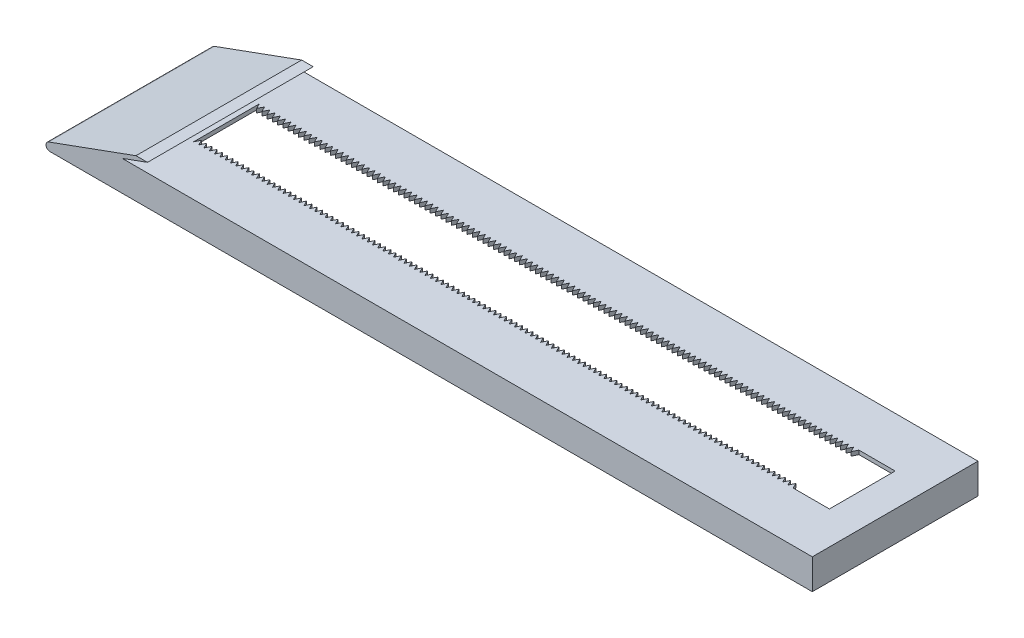
from build123d import *

# Parameters (mm, degrees)
BOSS_EXTRUDE1_DEPTH    = 120
BOSS_EXTRUDE2_DEPTH    = 3
BOSS_EXTRUDE3_DEPTH    = 3
SKETCH4_W              = 126
SKETCH4_H              = 23
BOSS_EXTRUDE4_DEPTH    = 3
SKETCH5_W              = 483.528980942
SKETCH5_H              = 50
CUT_EXTRUDE1_DEPTH     = 3
BOSS_EXTRUDE5_DEPTH    = 3
LPATTERN1_COUNT        = 114
LPATTERN1_PITCH        = 4
MIRROR1_COPY_1_DEPTH   = 3
MIRROR1_COPY_2_DEPTH   = 3
MIRROR1_COPY_3_DEPTH   = 3
MIRROR1_COPY_4_DEPTH   = 3
MIRROR1_COPY_5_DEPTH   = 3
MIRROR1_COPY_6_DEPTH   = 3
MIRROR1_COPY_7_DEPTH   = 3
MIRROR1_COPY_8_DEPTH   = 3
MIRROR1_COPY_9_DEPTH   = 3
MIRROR1_COPY_10_DEPTH  = 3
MIRROR1_COPY_11_DEPTH  = 3
MIRROR1_COPY_12_DEPTH  = 3
MIRROR1_COPY_13_DEPTH  = 3
MIRROR1_COPY_14_DEPTH  = 3
MIRROR1_COPY_15_DEPTH  = 3
MIRROR1_COPY_16_DEPTH  = 3
MIRROR1_COPY_17_DEPTH  = 3
MIRROR1_COPY_18_DEPTH  = 3
MIRROR1_COPY_19_DEPTH  = 3
MIRROR1_COPY_20_DEPTH  = 3
MIRROR1_COPY_21_DEPTH  = 3
MIRROR1_COPY_22_DEPTH  = 3
MIRROR1_COPY_23_DEPTH  = 3
MIRROR1_COPY_24_DEPTH  = 3
MIRROR1_COPY_25_DEPTH  = 3
MIRROR1_COPY_26_DEPTH  = 3
MIRROR1_COPY_27_DEPTH  = 3
MIRROR1_COPY_28_DEPTH  = 3
MIRROR1_COPY_29_DEPTH  = 3
MIRROR1_COPY_30_DEPTH  = 3
MIRROR1_COPY_31_DEPTH  = 3
MIRROR1_COPY_32_DEPTH  = 3
MIRROR1_COPY_33_DEPTH  = 3
MIRROR1_COPY_34_DEPTH  = 3
MIRROR1_COPY_35_DEPTH  = 3
MIRROR1_COPY_36_DEPTH  = 3
MIRROR1_COPY_37_DEPTH  = 3
MIRROR1_COPY_38_DEPTH  = 3
MIRROR1_COPY_39_DEPTH  = 3
MIRROR1_COPY_40_DEPTH  = 3
MIRROR1_COPY_41_DEPTH  = 3
MIRROR1_COPY_42_DEPTH  = 3
MIRROR1_COPY_43_DEPTH  = 3
MIRROR1_COPY_44_DEPTH  = 3
MIRROR1_COPY_45_DEPTH  = 3
MIRROR1_COPY_46_DEPTH  = 3
MIRROR1_COPY_47_DEPTH  = 3
MIRROR1_COPY_48_DEPTH  = 3
MIRROR1_COPY_49_DEPTH  = 3
MIRROR1_COPY_50_DEPTH  = 3
MIRROR1_COPY_51_DEPTH  = 3
MIRROR1_COPY_52_DEPTH  = 3
MIRROR1_COPY_53_DEPTH  = 3
MIRROR1_COPY_54_DEPTH  = 3
MIRROR1_COPY_55_DEPTH  = 3
MIRROR1_COPY_56_DEPTH  = 3
MIRROR1_COPY_57_DEPTH  = 3
MIRROR1_COPY_58_DEPTH  = 3
MIRROR1_COPY_59_DEPTH  = 3
MIRROR1_COPY_60_DEPTH  = 3
MIRROR1_COPY_61_DEPTH  = 3
MIRROR1_COPY_62_DEPTH  = 3
MIRROR1_COPY_63_DEPTH  = 3
MIRROR1_COPY_64_DEPTH  = 3
MIRROR1_COPY_65_DEPTH  = 3
MIRROR1_COPY_66_DEPTH  = 3
MIRROR1_COPY_67_DEPTH  = 3
MIRROR1_COPY_68_DEPTH  = 3
MIRROR1_COPY_69_DEPTH  = 3
MIRROR1_COPY_70_DEPTH  = 3
MIRROR1_COPY_71_DEPTH  = 3
MIRROR1_COPY_72_DEPTH  = 3
MIRROR1_COPY_73_DEPTH  = 3
MIRROR1_COPY_74_DEPTH  = 3
MIRROR1_COPY_75_DEPTH  = 3
MIRROR1_COPY_76_DEPTH  = 3
MIRROR1_COPY_77_DEPTH  = 3
MIRROR1_COPY_78_DEPTH  = 3
MIRROR1_COPY_79_DEPTH  = 3
MIRROR1_COPY_80_DEPTH  = 3
MIRROR1_COPY_81_DEPTH  = 3
MIRROR1_COPY_82_DEPTH  = 3
MIRROR1_COPY_83_DEPTH  = 3
MIRROR1_COPY_84_DEPTH  = 3
MIRROR1_COPY_85_DEPTH  = 3
MIRROR1_COPY_86_DEPTH  = 3
MIRROR1_COPY_87_DEPTH  = 3
MIRROR1_COPY_88_DEPTH  = 3
MIRROR1_COPY_89_DEPTH  = 3
MIRROR1_COPY_90_DEPTH  = 3
MIRROR1_COPY_91_DEPTH  = 3
MIRROR1_COPY_92_DEPTH  = 3
MIRROR1_COPY_93_DEPTH  = 3
MIRROR1_COPY_94_DEPTH  = 3
MIRROR1_COPY_95_DEPTH  = 3
MIRROR1_COPY_96_DEPTH  = 3
MIRROR1_COPY_97_DEPTH  = 3
MIRROR1_COPY_98_DEPTH  = 3
MIRROR1_COPY_99_DEPTH  = 3
MIRROR1_COPY_100_DEPTH = 3
MIRROR1_COPY_101_DEPTH = 3
MIRROR1_COPY_102_DEPTH = 3
MIRROR1_COPY_103_DEPTH = 3
MIRROR1_COPY_104_DEPTH = 3
MIRROR1_COPY_105_DEPTH = 3
MIRROR1_COPY_106_DEPTH = 3
MIRROR1_COPY_107_DEPTH = 3
MIRROR1_COPY_108_DEPTH = 3
MIRROR1_COPY_109_DEPTH = 3
MIRROR1_COPY_110_DEPTH = 3
MIRROR1_COPY_111_DEPTH = 3
MIRROR1_COPY_112_DEPTH = 3
MIRROR1_COPY_113_DEPTH = 3
BOSS_EXTRUDE6_DEPTH    = 126
FILLET1_R              = 3


with BuildPart() as part:
    # Sketch1 → Boss-Extrude1 (new body)
    with BuildSketch(Plane.XY):
        Polygon((0, 0), (530.528980942, 0), (530.528980942, -3), (0.528980942, -3), (-46.178135189, -20), (-33.191980647, -20), (-33.191980647, -23), (-63.191980647, -23), align=None)
    extrude(amount=BOSS_EXTRUDE1_DEPTH)

    # Sketch2 → Boss-Extrude2 (add)
    with BuildSketch(Plane.XY.offset(120)):
        Polygon((530.528980942, 0), (0, 0), (-63.191980647, -23), (530.528980942, -23), align=None)
    extrude(amount=BOSS_EXTRUDE2_DEPTH)

    # Sketch3 → Boss-Extrude3 (add)
    with BuildSketch(Plane(origin=(0, 0, 0), x_dir=(-1, 0, 0), z_dir=(0, 0, -1))):
        Polygon((-530.528980942, 0), (0, 0), (63.191980647, -23), (-530.528980942, -23), align=None)
    extrude(amount=BOSS_EXTRUDE3_DEPTH)

    # Sketch4 → Boss-Extrude4 (add)
    with BuildSketch(Plane(origin=(530.528980942, 0, 0), x_dir=(0, 0, -1), z_dir=(1, 0, 0))):
        with Locations((-60, -11.5)):
            Rectangle(SKETCH4_W, SKETCH4_H)
    extrude(amount=BOSS_EXTRUDE4_DEPTH)

    # Sketch5 → Cut-Extrude1 (cut)
    with BuildSketch(Plane(origin=(0, 0, 0), x_dir=(1, 0, 0), z_dir=(0, 1, 0))):
        with Locations((266.764490471, -60)):
            Rectangle(SKETCH5_W, SKETCH5_H)
    extrude(amount=-CUT_EXTRUDE1_DEPTH, mode=Mode.SUBTRACT)

    # Sketch6 → Boss-Extrude5 (add)
    with BuildSketch(Plane(origin=(0, 0, 0), x_dir=(1, 0, 0), z_dir=(0, 1, 0))):
        Polygon((25, -35), (27, -39), (29, -35), align=None)
    boss_extrude5 = extrude(amount=-BOSS_EXTRUDE5_DEPTH)

    # LPattern1: Boss-Extrude5 ×114
    with Locations(*[(i * LPATTERN1_PITCH, 0, 0) for i in range(1, LPATTERN1_COUNT)]):
        add(boss_extrude5)

    # Mirror1: Boss-Extrude5 across plane
    add(boss_extrude5.mirror(Plane.XY.offset(60)))

    # Mirror1 copy 1 sketch → Mirror1 copy 1 (add)
    with BuildSketch(Plane(origin=(4, 0, 120), x_dir=(1, 0, 0), z_dir=(0, 1, 0))):
        Polygon((25, 35), (27, 39), (29, 35), align=None)
    extrude(amount=-MIRROR1_COPY_1_DEPTH)

    # Mirror1 copy 2 sketch → Mirror1 copy 2 (add)
    with BuildSketch(Plane(origin=(8, 0, 120), x_dir=(1, 0, 0), z_dir=(0, 1, 0))):
        Polygon((25, 35), (27, 39), (29, 35), align=None)
    extrude(amount=-MIRROR1_COPY_2_DEPTH)

    # Mirror1 copy 3 sketch → Mirror1 copy 3 (add)
    with BuildSketch(Plane(origin=(12, 0, 120), x_dir=(1, 0, 0), z_dir=(0, 1, 0))):
        Polygon((25, 35), (27, 39), (29, 35), align=None)
    extrude(amount=-MIRROR1_COPY_3_DEPTH)

    # Mirror1 copy 4 sketch → Mirror1 copy 4 (add)
    with BuildSketch(Plane(origin=(16, 0, 120), x_dir=(1, 0, 0), z_dir=(0, 1, 0))):
        Polygon((25, 35), (27, 39), (29, 35), align=None)
    extrude(amount=-MIRROR1_COPY_4_DEPTH)

    # Mirror1 copy 5 sketch → Mirror1 copy 5 (add)
    with BuildSketch(Plane(origin=(20, 0, 120), x_dir=(1, 0, 0), z_dir=(0, 1, 0))):
        Polygon((25, 35), (27, 39), (29, 35), align=None)
    extrude(amount=-MIRROR1_COPY_5_DEPTH)

    # Mirror1 copy 6 sketch → Mirror1 copy 6 (add)
    with BuildSketch(Plane(origin=(24, 0, 120), x_dir=(1, 0, 0), z_dir=(0, 1, 0))):
        Polygon((25, 35), (27, 39), (29, 35), align=None)
    extrude(amount=-MIRROR1_COPY_6_DEPTH)

    # Mirror1 copy 7 sketch → Mirror1 copy 7 (add)
    with BuildSketch(Plane(origin=(28, 0, 120), x_dir=(1, 0, 0), z_dir=(0, 1, 0))):
        Polygon((25, 35), (27, 39), (29, 35), align=None)
    extrude(amount=-MIRROR1_COPY_7_DEPTH)

    # Mirror1 copy 8 sketch → Mirror1 copy 8 (add)
    with BuildSketch(Plane(origin=(32, 0, 120), x_dir=(1, 0, 0), z_dir=(0, 1, 0))):
        Polygon((25, 35), (27, 39), (29, 35), align=None)
    extrude(amount=-MIRROR1_COPY_8_DEPTH)

    # Mirror1 copy 9 sketch → Mirror1 copy 9 (add)
    with BuildSketch(Plane(origin=(36, 0, 120), x_dir=(1, 0, 0), z_dir=(0, 1, 0))):
        Polygon((25, 35), (27, 39), (29, 35), align=None)
    extrude(amount=-MIRROR1_COPY_9_DEPTH)

    # Mirror1 copy 10 sketch → Mirror1 copy 10 (add)
    with BuildSketch(Plane(origin=(40, 0, 120), x_dir=(1, 0, 0), z_dir=(0, 1, 0))):
        Polygon((25, 35), (27, 39), (29, 35), align=None)
    extrude(amount=-MIRROR1_COPY_10_DEPTH)

    # Mirror1 copy 11 sketch → Mirror1 copy 11 (add)
    with BuildSketch(Plane(origin=(44, 0, 120), x_dir=(1, 0, 0), z_dir=(0, 1, 0))):
        Polygon((25, 35), (27, 39), (29, 35), align=None)
    extrude(amount=-MIRROR1_COPY_11_DEPTH)

    # Mirror1 copy 12 sketch → Mirror1 copy 12 (add)
    with BuildSketch(Plane(origin=(48, 0, 120), x_dir=(1, 0, 0), z_dir=(0, 1, 0))):
        Polygon((25, 35), (27, 39), (29, 35), align=None)
    extrude(amount=-MIRROR1_COPY_12_DEPTH)

    # Mirror1 copy 13 sketch → Mirror1 copy 13 (add)
    with BuildSketch(Plane(origin=(52, 0, 120), x_dir=(1, 0, 0), z_dir=(0, 1, 0))):
        Polygon((25, 35), (27, 39), (29, 35), align=None)
    extrude(amount=-MIRROR1_COPY_13_DEPTH)

    # Mirror1 copy 14 sketch → Mirror1 copy 14 (add)
    with BuildSketch(Plane(origin=(56, 0, 120), x_dir=(1, 0, 0), z_dir=(0, 1, 0))):
        Polygon((25, 35), (27, 39), (29, 35), align=None)
    extrude(amount=-MIRROR1_COPY_14_DEPTH)

    # Mirror1 copy 15 sketch → Mirror1 copy 15 (add)
    with BuildSketch(Plane(origin=(60, 0, 120), x_dir=(1, 0, 0), z_dir=(0, 1, 0))):
        Polygon((25, 35), (27, 39), (29, 35), align=None)
    extrude(amount=-MIRROR1_COPY_15_DEPTH)

    # Mirror1 copy 16 sketch → Mirror1 copy 16 (add)
    with BuildSketch(Plane(origin=(64, 0, 120), x_dir=(1, 0, 0), z_dir=(0, 1, 0))):
        Polygon((25, 35), (27, 39), (29, 35), align=None)
    extrude(amount=-MIRROR1_COPY_16_DEPTH)

    # Mirror1 copy 17 sketch → Mirror1 copy 17 (add)
    with BuildSketch(Plane(origin=(68, 0, 120), x_dir=(1, 0, 0), z_dir=(0, 1, 0))):
        Polygon((25, 35), (27, 39), (29, 35), align=None)
    extrude(amount=-MIRROR1_COPY_17_DEPTH)

    # Mirror1 copy 18 sketch → Mirror1 copy 18 (add)
    with BuildSketch(Plane(origin=(72, 0, 120), x_dir=(1, 0, 0), z_dir=(0, 1, 0))):
        Polygon((25, 35), (27, 39), (29, 35), align=None)
    extrude(amount=-MIRROR1_COPY_18_DEPTH)

    # Mirror1 copy 19 sketch → Mirror1 copy 19 (add)
    with BuildSketch(Plane(origin=(76, 0, 120), x_dir=(1, 0, 0), z_dir=(0, 1, 0))):
        Polygon((25, 35), (27, 39), (29, 35), align=None)
    extrude(amount=-MIRROR1_COPY_19_DEPTH)

    # Mirror1 copy 20 sketch → Mirror1 copy 20 (add)
    with BuildSketch(Plane(origin=(80, 0, 120), x_dir=(1, 0, 0), z_dir=(0, 1, 0))):
        Polygon((25, 35), (27, 39), (29, 35), align=None)
    extrude(amount=-MIRROR1_COPY_20_DEPTH)

    # Mirror1 copy 21 sketch → Mirror1 copy 21 (add)
    with BuildSketch(Plane(origin=(84, 0, 120), x_dir=(1, 0, 0), z_dir=(0, 1, 0))):
        Polygon((25, 35), (27, 39), (29, 35), align=None)
    extrude(amount=-MIRROR1_COPY_21_DEPTH)

    # Mirror1 copy 22 sketch → Mirror1 copy 22 (add)
    with BuildSketch(Plane(origin=(88, 0, 120), x_dir=(1, 0, 0), z_dir=(0, 1, 0))):
        Polygon((25, 35), (27, 39), (29, 35), align=None)
    extrude(amount=-MIRROR1_COPY_22_DEPTH)

    # Mirror1 copy 23 sketch → Mirror1 copy 23 (add)
    with BuildSketch(Plane(origin=(92, 0, 120), x_dir=(1, 0, 0), z_dir=(0, 1, 0))):
        Polygon((25, 35), (27, 39), (29, 35), align=None)
    extrude(amount=-MIRROR1_COPY_23_DEPTH)

    # Mirror1 copy 24 sketch → Mirror1 copy 24 (add)
    with BuildSketch(Plane(origin=(96, 0, 120), x_dir=(1, 0, 0), z_dir=(0, 1, 0))):
        Polygon((25, 35), (27, 39), (29, 35), align=None)
    extrude(amount=-MIRROR1_COPY_24_DEPTH)

    # Mirror1 copy 25 sketch → Mirror1 copy 25 (add)
    with BuildSketch(Plane(origin=(100, 0, 120), x_dir=(1, 0, 0), z_dir=(0, 1, 0))):
        Polygon((25, 35), (27, 39), (29, 35), align=None)
    extrude(amount=-MIRROR1_COPY_25_DEPTH)

    # Mirror1 copy 26 sketch → Mirror1 copy 26 (add)
    with BuildSketch(Plane(origin=(104, 0, 120), x_dir=(1, 0, 0), z_dir=(0, 1, 0))):
        Polygon((25, 35), (27, 39), (29, 35), align=None)
    extrude(amount=-MIRROR1_COPY_26_DEPTH)

    # Mirror1 copy 27 sketch → Mirror1 copy 27 (add)
    with BuildSketch(Plane(origin=(108, 0, 120), x_dir=(1, 0, 0), z_dir=(0, 1, 0))):
        Polygon((25, 35), (27, 39), (29, 35), align=None)
    extrude(amount=-MIRROR1_COPY_27_DEPTH)

    # Mirror1 copy 28 sketch → Mirror1 copy 28 (add)
    with BuildSketch(Plane(origin=(112, 0, 120), x_dir=(1, 0, 0), z_dir=(0, 1, 0))):
        Polygon((25, 35), (27, 39), (29, 35), align=None)
    extrude(amount=-MIRROR1_COPY_28_DEPTH)

    # Mirror1 copy 29 sketch → Mirror1 copy 29 (add)
    with BuildSketch(Plane(origin=(116, 0, 120), x_dir=(1, 0, 0), z_dir=(0, 1, 0))):
        Polygon((25, 35), (27, 39), (29, 35), align=None)
    extrude(amount=-MIRROR1_COPY_29_DEPTH)

    # Mirror1 copy 30 sketch → Mirror1 copy 30 (add)
    with BuildSketch(Plane(origin=(120, 0, 120), x_dir=(1, 0, 0), z_dir=(0, 1, 0))):
        Polygon((25, 35), (27, 39), (29, 35), align=None)
    extrude(amount=-MIRROR1_COPY_30_DEPTH)

    # Mirror1 copy 31 sketch → Mirror1 copy 31 (add)
    with BuildSketch(Plane(origin=(124, 0, 120), x_dir=(1, 0, 0), z_dir=(0, 1, 0))):
        Polygon((25, 35), (27, 39), (29, 35), align=None)
    extrude(amount=-MIRROR1_COPY_31_DEPTH)

    # Mirror1 copy 32 sketch → Mirror1 copy 32 (add)
    with BuildSketch(Plane(origin=(128, 0, 120), x_dir=(1, 0, 0), z_dir=(0, 1, 0))):
        Polygon((25, 35), (27, 39), (29, 35), align=None)
    extrude(amount=-MIRROR1_COPY_32_DEPTH)

    # Mirror1 copy 33 sketch → Mirror1 copy 33 (add)
    with BuildSketch(Plane(origin=(132, 0, 120), x_dir=(1, 0, 0), z_dir=(0, 1, 0))):
        Polygon((25, 35), (27, 39), (29, 35), align=None)
    extrude(amount=-MIRROR1_COPY_33_DEPTH)

    # Mirror1 copy 34 sketch → Mirror1 copy 34 (add)
    with BuildSketch(Plane(origin=(136, 0, 120), x_dir=(1, 0, 0), z_dir=(0, 1, 0))):
        Polygon((25, 35), (27, 39), (29, 35), align=None)
    extrude(amount=-MIRROR1_COPY_34_DEPTH)

    # Mirror1 copy 35 sketch → Mirror1 copy 35 (add)
    with BuildSketch(Plane(origin=(140, 0, 120), x_dir=(1, 0, 0), z_dir=(0, 1, 0))):
        Polygon((25, 35), (27, 39), (29, 35), align=None)
    extrude(amount=-MIRROR1_COPY_35_DEPTH)

    # Mirror1 copy 36 sketch → Mirror1 copy 36 (add)
    with BuildSketch(Plane(origin=(144, 0, 120), x_dir=(1, 0, 0), z_dir=(0, 1, 0))):
        Polygon((25, 35), (27, 39), (29, 35), align=None)
    extrude(amount=-MIRROR1_COPY_36_DEPTH)

    # Mirror1 copy 37 sketch → Mirror1 copy 37 (add)
    with BuildSketch(Plane(origin=(148, 0, 120), x_dir=(1, 0, 0), z_dir=(0, 1, 0))):
        Polygon((25, 35), (27, 39), (29, 35), align=None)
    extrude(amount=-MIRROR1_COPY_37_DEPTH)

    # Mirror1 copy 38 sketch → Mirror1 copy 38 (add)
    with BuildSketch(Plane(origin=(152, 0, 120), x_dir=(1, 0, 0), z_dir=(0, 1, 0))):
        Polygon((25, 35), (27, 39), (29, 35), align=None)
    extrude(amount=-MIRROR1_COPY_38_DEPTH)

    # Mirror1 copy 39 sketch → Mirror1 copy 39 (add)
    with BuildSketch(Plane(origin=(156, 0, 120), x_dir=(1, 0, 0), z_dir=(0, 1, 0))):
        Polygon((25, 35), (27, 39), (29, 35), align=None)
    extrude(amount=-MIRROR1_COPY_39_DEPTH)

    # Mirror1 copy 40 sketch → Mirror1 copy 40 (add)
    with BuildSketch(Plane(origin=(160, 0, 120), x_dir=(1, 0, 0), z_dir=(0, 1, 0))):
        Polygon((25, 35), (27, 39), (29, 35), align=None)
    extrude(amount=-MIRROR1_COPY_40_DEPTH)

    # Mirror1 copy 41 sketch → Mirror1 copy 41 (add)
    with BuildSketch(Plane(origin=(164, 0, 120), x_dir=(1, 0, 0), z_dir=(0, 1, 0))):
        Polygon((25, 35), (27, 39), (29, 35), align=None)
    extrude(amount=-MIRROR1_COPY_41_DEPTH)

    # Mirror1 copy 42 sketch → Mirror1 copy 42 (add)
    with BuildSketch(Plane(origin=(168, 0, 120), x_dir=(1, 0, 0), z_dir=(0, 1, 0))):
        Polygon((25, 35), (27, 39), (29, 35), align=None)
    extrude(amount=-MIRROR1_COPY_42_DEPTH)

    # Mirror1 copy 43 sketch → Mirror1 copy 43 (add)
    with BuildSketch(Plane(origin=(172, 0, 120), x_dir=(1, 0, 0), z_dir=(0, 1, 0))):
        Polygon((25, 35), (27, 39), (29, 35), align=None)
    extrude(amount=-MIRROR1_COPY_43_DEPTH)

    # Mirror1 copy 44 sketch → Mirror1 copy 44 (add)
    with BuildSketch(Plane(origin=(176, 0, 120), x_dir=(1, 0, 0), z_dir=(0, 1, 0))):
        Polygon((25, 35), (27, 39), (29, 35), align=None)
    extrude(amount=-MIRROR1_COPY_44_DEPTH)

    # Mirror1 copy 45 sketch → Mirror1 copy 45 (add)
    with BuildSketch(Plane(origin=(180, 0, 120), x_dir=(1, 0, 0), z_dir=(0, 1, 0))):
        Polygon((25, 35), (27, 39), (29, 35), align=None)
    extrude(amount=-MIRROR1_COPY_45_DEPTH)

    # Mirror1 copy 46 sketch → Mirror1 copy 46 (add)
    with BuildSketch(Plane(origin=(184, 0, 120), x_dir=(1, 0, 0), z_dir=(0, 1, 0))):
        Polygon((25, 35), (27, 39), (29, 35), align=None)
    extrude(amount=-MIRROR1_COPY_46_DEPTH)

    # Mirror1 copy 47 sketch → Mirror1 copy 47 (add)
    with BuildSketch(Plane(origin=(188, 0, 120), x_dir=(1, 0, 0), z_dir=(0, 1, 0))):
        Polygon((25, 35), (27, 39), (29, 35), align=None)
    extrude(amount=-MIRROR1_COPY_47_DEPTH)

    # Mirror1 copy 48 sketch → Mirror1 copy 48 (add)
    with BuildSketch(Plane(origin=(192, 0, 120), x_dir=(1, 0, 0), z_dir=(0, 1, 0))):
        Polygon((25, 35), (27, 39), (29, 35), align=None)
    extrude(amount=-MIRROR1_COPY_48_DEPTH)

    # Mirror1 copy 49 sketch → Mirror1 copy 49 (add)
    with BuildSketch(Plane(origin=(196, 0, 120), x_dir=(1, 0, 0), z_dir=(0, 1, 0))):
        Polygon((25, 35), (27, 39), (29, 35), align=None)
    extrude(amount=-MIRROR1_COPY_49_DEPTH)

    # Mirror1 copy 50 sketch → Mirror1 copy 50 (add)
    with BuildSketch(Plane(origin=(200, 0, 120), x_dir=(1, 0, 0), z_dir=(0, 1, 0))):
        Polygon((25, 35), (27, 39), (29, 35), align=None)
    extrude(amount=-MIRROR1_COPY_50_DEPTH)

    # Mirror1 copy 51 sketch → Mirror1 copy 51 (add)
    with BuildSketch(Plane(origin=(204, 0, 120), x_dir=(1, 0, 0), z_dir=(0, 1, 0))):
        Polygon((25, 35), (27, 39), (29, 35), align=None)
    extrude(amount=-MIRROR1_COPY_51_DEPTH)

    # Mirror1 copy 52 sketch → Mirror1 copy 52 (add)
    with BuildSketch(Plane(origin=(208, 0, 120), x_dir=(1, 0, 0), z_dir=(0, 1, 0))):
        Polygon((25, 35), (27, 39), (29, 35), align=None)
    extrude(amount=-MIRROR1_COPY_52_DEPTH)

    # Mirror1 copy 53 sketch → Mirror1 copy 53 (add)
    with BuildSketch(Plane(origin=(212, 0, 120), x_dir=(1, 0, 0), z_dir=(0, 1, 0))):
        Polygon((25, 35), (27, 39), (29, 35), align=None)
    extrude(amount=-MIRROR1_COPY_53_DEPTH)

    # Mirror1 copy 54 sketch → Mirror1 copy 54 (add)
    with BuildSketch(Plane(origin=(216, 0, 120), x_dir=(1, 0, 0), z_dir=(0, 1, 0))):
        Polygon((25, 35), (27, 39), (29, 35), align=None)
    extrude(amount=-MIRROR1_COPY_54_DEPTH)

    # Mirror1 copy 55 sketch → Mirror1 copy 55 (add)
    with BuildSketch(Plane(origin=(220, 0, 120), x_dir=(1, 0, 0), z_dir=(0, 1, 0))):
        Polygon((25, 35), (27, 39), (29, 35), align=None)
    extrude(amount=-MIRROR1_COPY_55_DEPTH)

    # Mirror1 copy 56 sketch → Mirror1 copy 56 (add)
    with BuildSketch(Plane(origin=(224, 0, 120), x_dir=(1, 0, 0), z_dir=(0, 1, 0))):
        Polygon((25, 35), (27, 39), (29, 35), align=None)
    extrude(amount=-MIRROR1_COPY_56_DEPTH)

    # Mirror1 copy 57 sketch → Mirror1 copy 57 (add)
    with BuildSketch(Plane(origin=(228, 0, 120), x_dir=(1, 0, 0), z_dir=(0, 1, 0))):
        Polygon((25, 35), (27, 39), (29, 35), align=None)
    extrude(amount=-MIRROR1_COPY_57_DEPTH)

    # Mirror1 copy 58 sketch → Mirror1 copy 58 (add)
    with BuildSketch(Plane(origin=(232, 0, 120), x_dir=(1, 0, 0), z_dir=(0, 1, 0))):
        Polygon((25, 35), (27, 39), (29, 35), align=None)
    extrude(amount=-MIRROR1_COPY_58_DEPTH)

    # Mirror1 copy 59 sketch → Mirror1 copy 59 (add)
    with BuildSketch(Plane(origin=(236, 0, 120), x_dir=(1, 0, 0), z_dir=(0, 1, 0))):
        Polygon((25, 35), (27, 39), (29, 35), align=None)
    extrude(amount=-MIRROR1_COPY_59_DEPTH)

    # Mirror1 copy 60 sketch → Mirror1 copy 60 (add)
    with BuildSketch(Plane(origin=(240, 0, 120), x_dir=(1, 0, 0), z_dir=(0, 1, 0))):
        Polygon((25, 35), (27, 39), (29, 35), align=None)
    extrude(amount=-MIRROR1_COPY_60_DEPTH)

    # Mirror1 copy 61 sketch → Mirror1 copy 61 (add)
    with BuildSketch(Plane(origin=(244, 0, 120), x_dir=(1, 0, 0), z_dir=(0, 1, 0))):
        Polygon((25, 35), (27, 39), (29, 35), align=None)
    extrude(amount=-MIRROR1_COPY_61_DEPTH)

    # Mirror1 copy 62 sketch → Mirror1 copy 62 (add)
    with BuildSketch(Plane(origin=(248, 0, 120), x_dir=(1, 0, 0), z_dir=(0, 1, 0))):
        Polygon((25, 35), (27, 39), (29, 35), align=None)
    extrude(amount=-MIRROR1_COPY_62_DEPTH)

    # Mirror1 copy 63 sketch → Mirror1 copy 63 (add)
    with BuildSketch(Plane(origin=(252, 0, 120), x_dir=(1, 0, 0), z_dir=(0, 1, 0))):
        Polygon((25, 35), (27, 39), (29, 35), align=None)
    extrude(amount=-MIRROR1_COPY_63_DEPTH)

    # Mirror1 copy 64 sketch → Mirror1 copy 64 (add)
    with BuildSketch(Plane(origin=(256, 0, 120), x_dir=(1, 0, 0), z_dir=(0, 1, 0))):
        Polygon((25, 35), (27, 39), (29, 35), align=None)
    extrude(amount=-MIRROR1_COPY_64_DEPTH)

    # Mirror1 copy 65 sketch → Mirror1 copy 65 (add)
    with BuildSketch(Plane(origin=(260, 0, 120), x_dir=(1, 0, 0), z_dir=(0, 1, 0))):
        Polygon((25, 35), (27, 39), (29, 35), align=None)
    extrude(amount=-MIRROR1_COPY_65_DEPTH)

    # Mirror1 copy 66 sketch → Mirror1 copy 66 (add)
    with BuildSketch(Plane(origin=(264, 0, 120), x_dir=(1, 0, 0), z_dir=(0, 1, 0))):
        Polygon((25, 35), (27, 39), (29, 35), align=None)
    extrude(amount=-MIRROR1_COPY_66_DEPTH)

    # Mirror1 copy 67 sketch → Mirror1 copy 67 (add)
    with BuildSketch(Plane(origin=(268, 0, 120), x_dir=(1, 0, 0), z_dir=(0, 1, 0))):
        Polygon((25, 35), (27, 39), (29, 35), align=None)
    extrude(amount=-MIRROR1_COPY_67_DEPTH)

    # Mirror1 copy 68 sketch → Mirror1 copy 68 (add)
    with BuildSketch(Plane(origin=(272, 0, 120), x_dir=(1, 0, 0), z_dir=(0, 1, 0))):
        Polygon((25, 35), (27, 39), (29, 35), align=None)
    extrude(amount=-MIRROR1_COPY_68_DEPTH)

    # Mirror1 copy 69 sketch → Mirror1 copy 69 (add)
    with BuildSketch(Plane(origin=(276, 0, 120), x_dir=(1, 0, 0), z_dir=(0, 1, 0))):
        Polygon((25, 35), (27, 39), (29, 35), align=None)
    extrude(amount=-MIRROR1_COPY_69_DEPTH)

    # Mirror1 copy 70 sketch → Mirror1 copy 70 (add)
    with BuildSketch(Plane(origin=(280, 0, 120), x_dir=(1, 0, 0), z_dir=(0, 1, 0))):
        Polygon((25, 35), (27, 39), (29, 35), align=None)
    extrude(amount=-MIRROR1_COPY_70_DEPTH)

    # Mirror1 copy 71 sketch → Mirror1 copy 71 (add)
    with BuildSketch(Plane(origin=(284, 0, 120), x_dir=(1, 0, 0), z_dir=(0, 1, 0))):
        Polygon((25, 35), (27, 39), (29, 35), align=None)
    extrude(amount=-MIRROR1_COPY_71_DEPTH)

    # Mirror1 copy 72 sketch → Mirror1 copy 72 (add)
    with BuildSketch(Plane(origin=(288, 0, 120), x_dir=(1, 0, 0), z_dir=(0, 1, 0))):
        Polygon((25, 35), (27, 39), (29, 35), align=None)
    extrude(amount=-MIRROR1_COPY_72_DEPTH)

    # Mirror1 copy 73 sketch → Mirror1 copy 73 (add)
    with BuildSketch(Plane(origin=(292, 0, 120), x_dir=(1, 0, 0), z_dir=(0, 1, 0))):
        Polygon((25, 35), (27, 39), (29, 35), align=None)
    extrude(amount=-MIRROR1_COPY_73_DEPTH)

    # Mirror1 copy 74 sketch → Mirror1 copy 74 (add)
    with BuildSketch(Plane(origin=(296, 0, 120), x_dir=(1, 0, 0), z_dir=(0, 1, 0))):
        Polygon((25, 35), (27, 39), (29, 35), align=None)
    extrude(amount=-MIRROR1_COPY_74_DEPTH)

    # Mirror1 copy 75 sketch → Mirror1 copy 75 (add)
    with BuildSketch(Plane(origin=(300, 0, 120), x_dir=(1, 0, 0), z_dir=(0, 1, 0))):
        Polygon((25, 35), (27, 39), (29, 35), align=None)
    extrude(amount=-MIRROR1_COPY_75_DEPTH)

    # Mirror1 copy 76 sketch → Mirror1 copy 76 (add)
    with BuildSketch(Plane(origin=(304, 0, 120), x_dir=(1, 0, 0), z_dir=(0, 1, 0))):
        Polygon((25, 35), (27, 39), (29, 35), align=None)
    extrude(amount=-MIRROR1_COPY_76_DEPTH)

    # Mirror1 copy 77 sketch → Mirror1 copy 77 (add)
    with BuildSketch(Plane(origin=(308, 0, 120), x_dir=(1, 0, 0), z_dir=(0, 1, 0))):
        Polygon((25, 35), (27, 39), (29, 35), align=None)
    extrude(amount=-MIRROR1_COPY_77_DEPTH)

    # Mirror1 copy 78 sketch → Mirror1 copy 78 (add)
    with BuildSketch(Plane(origin=(312, 0, 120), x_dir=(1, 0, 0), z_dir=(0, 1, 0))):
        Polygon((25, 35), (27, 39), (29, 35), align=None)
    extrude(amount=-MIRROR1_COPY_78_DEPTH)

    # Mirror1 copy 79 sketch → Mirror1 copy 79 (add)
    with BuildSketch(Plane(origin=(316, 0, 120), x_dir=(1, 0, 0), z_dir=(0, 1, 0))):
        Polygon((25, 35), (27, 39), (29, 35), align=None)
    extrude(amount=-MIRROR1_COPY_79_DEPTH)

    # Mirror1 copy 80 sketch → Mirror1 copy 80 (add)
    with BuildSketch(Plane(origin=(320, 0, 120), x_dir=(1, 0, 0), z_dir=(0, 1, 0))):
        Polygon((25, 35), (27, 39), (29, 35), align=None)
    extrude(amount=-MIRROR1_COPY_80_DEPTH)

    # Mirror1 copy 81 sketch → Mirror1 copy 81 (add)
    with BuildSketch(Plane(origin=(324, 0, 120), x_dir=(1, 0, 0), z_dir=(0, 1, 0))):
        Polygon((25, 35), (27, 39), (29, 35), align=None)
    extrude(amount=-MIRROR1_COPY_81_DEPTH)

    # Mirror1 copy 82 sketch → Mirror1 copy 82 (add)
    with BuildSketch(Plane(origin=(328, 0, 120), x_dir=(1, 0, 0), z_dir=(0, 1, 0))):
        Polygon((25, 35), (27, 39), (29, 35), align=None)
    extrude(amount=-MIRROR1_COPY_82_DEPTH)

    # Mirror1 copy 83 sketch → Mirror1 copy 83 (add)
    with BuildSketch(Plane(origin=(332, 0, 120), x_dir=(1, 0, 0), z_dir=(0, 1, 0))):
        Polygon((25, 35), (27, 39), (29, 35), align=None)
    extrude(amount=-MIRROR1_COPY_83_DEPTH)

    # Mirror1 copy 84 sketch → Mirror1 copy 84 (add)
    with BuildSketch(Plane(origin=(336, 0, 120), x_dir=(1, 0, 0), z_dir=(0, 1, 0))):
        Polygon((25, 35), (27, 39), (29, 35), align=None)
    extrude(amount=-MIRROR1_COPY_84_DEPTH)

    # Mirror1 copy 85 sketch → Mirror1 copy 85 (add)
    with BuildSketch(Plane(origin=(340, 0, 120), x_dir=(1, 0, 0), z_dir=(0, 1, 0))):
        Polygon((25, 35), (27, 39), (29, 35), align=None)
    extrude(amount=-MIRROR1_COPY_85_DEPTH)

    # Mirror1 copy 86 sketch → Mirror1 copy 86 (add)
    with BuildSketch(Plane(origin=(344, 0, 120), x_dir=(1, 0, 0), z_dir=(0, 1, 0))):
        Polygon((25, 35), (27, 39), (29, 35), align=None)
    extrude(amount=-MIRROR1_COPY_86_DEPTH)

    # Mirror1 copy 87 sketch → Mirror1 copy 87 (add)
    with BuildSketch(Plane(origin=(348, 0, 120), x_dir=(1, 0, 0), z_dir=(0, 1, 0))):
        Polygon((25, 35), (27, 39), (29, 35), align=None)
    extrude(amount=-MIRROR1_COPY_87_DEPTH)

    # Mirror1 copy 88 sketch → Mirror1 copy 88 (add)
    with BuildSketch(Plane(origin=(352, 0, 120), x_dir=(1, 0, 0), z_dir=(0, 1, 0))):
        Polygon((25, 35), (27, 39), (29, 35), align=None)
    extrude(amount=-MIRROR1_COPY_88_DEPTH)

    # Mirror1 copy 89 sketch → Mirror1 copy 89 (add)
    with BuildSketch(Plane(origin=(356, 0, 120), x_dir=(1, 0, 0), z_dir=(0, 1, 0))):
        Polygon((25, 35), (27, 39), (29, 35), align=None)
    extrude(amount=-MIRROR1_COPY_89_DEPTH)

    # Mirror1 copy 90 sketch → Mirror1 copy 90 (add)
    with BuildSketch(Plane(origin=(360, 0, 120), x_dir=(1, 0, 0), z_dir=(0, 1, 0))):
        Polygon((25, 35), (27, 39), (29, 35), align=None)
    extrude(amount=-MIRROR1_COPY_90_DEPTH)

    # Mirror1 copy 91 sketch → Mirror1 copy 91 (add)
    with BuildSketch(Plane(origin=(364, 0, 120), x_dir=(1, 0, 0), z_dir=(0, 1, 0))):
        Polygon((25, 35), (27, 39), (29, 35), align=None)
    extrude(amount=-MIRROR1_COPY_91_DEPTH)

    # Mirror1 copy 92 sketch → Mirror1 copy 92 (add)
    with BuildSketch(Plane(origin=(368, 0, 120), x_dir=(1, 0, 0), z_dir=(0, 1, 0))):
        Polygon((25, 35), (27, 39), (29, 35), align=None)
    extrude(amount=-MIRROR1_COPY_92_DEPTH)

    # Mirror1 copy 93 sketch → Mirror1 copy 93 (add)
    with BuildSketch(Plane(origin=(372, 0, 120), x_dir=(1, 0, 0), z_dir=(0, 1, 0))):
        Polygon((25, 35), (27, 39), (29, 35), align=None)
    extrude(amount=-MIRROR1_COPY_93_DEPTH)

    # Mirror1 copy 94 sketch → Mirror1 copy 94 (add)
    with BuildSketch(Plane(origin=(376, 0, 120), x_dir=(1, 0, 0), z_dir=(0, 1, 0))):
        Polygon((25, 35), (27, 39), (29, 35), align=None)
    extrude(amount=-MIRROR1_COPY_94_DEPTH)

    # Mirror1 copy 95 sketch → Mirror1 copy 95 (add)
    with BuildSketch(Plane(origin=(380, 0, 120), x_dir=(1, 0, 0), z_dir=(0, 1, 0))):
        Polygon((25, 35), (27, 39), (29, 35), align=None)
    extrude(amount=-MIRROR1_COPY_95_DEPTH)

    # Mirror1 copy 96 sketch → Mirror1 copy 96 (add)
    with BuildSketch(Plane(origin=(384, 0, 120), x_dir=(1, 0, 0), z_dir=(0, 1, 0))):
        Polygon((25, 35), (27, 39), (29, 35), align=None)
    extrude(amount=-MIRROR1_COPY_96_DEPTH)

    # Mirror1 copy 97 sketch → Mirror1 copy 97 (add)
    with BuildSketch(Plane(origin=(388, 0, 120), x_dir=(1, 0, 0), z_dir=(0, 1, 0))):
        Polygon((25, 35), (27, 39), (29, 35), align=None)
    extrude(amount=-MIRROR1_COPY_97_DEPTH)

    # Mirror1 copy 98 sketch → Mirror1 copy 98 (add)
    with BuildSketch(Plane(origin=(392, 0, 120), x_dir=(1, 0, 0), z_dir=(0, 1, 0))):
        Polygon((25, 35), (27, 39), (29, 35), align=None)
    extrude(amount=-MIRROR1_COPY_98_DEPTH)

    # Mirror1 copy 99 sketch → Mirror1 copy 99 (add)
    with BuildSketch(Plane(origin=(396, 0, 120), x_dir=(1, 0, 0), z_dir=(0, 1, 0))):
        Polygon((25, 35), (27, 39), (29, 35), align=None)
    extrude(amount=-MIRROR1_COPY_99_DEPTH)

    # Mirror1 copy 100 sketch → Mirror1 copy 100 (add)
    with BuildSketch(Plane(origin=(400, 0, 120), x_dir=(1, 0, 0), z_dir=(0, 1, 0))):
        Polygon((25, 35), (27, 39), (29, 35), align=None)
    extrude(amount=-MIRROR1_COPY_100_DEPTH)

    # Mirror1 copy 101 sketch → Mirror1 copy 101 (add)
    with BuildSketch(Plane(origin=(404, 0, 120), x_dir=(1, 0, 0), z_dir=(0, 1, 0))):
        Polygon((25, 35), (27, 39), (29, 35), align=None)
    extrude(amount=-MIRROR1_COPY_101_DEPTH)

    # Mirror1 copy 102 sketch → Mirror1 copy 102 (add)
    with BuildSketch(Plane(origin=(408, 0, 120), x_dir=(1, 0, 0), z_dir=(0, 1, 0))):
        Polygon((25, 35), (27, 39), (29, 35), align=None)
    extrude(amount=-MIRROR1_COPY_102_DEPTH)

    # Mirror1 copy 103 sketch → Mirror1 copy 103 (add)
    with BuildSketch(Plane(origin=(412, 0, 120), x_dir=(1, 0, 0), z_dir=(0, 1, 0))):
        Polygon((25, 35), (27, 39), (29, 35), align=None)
    extrude(amount=-MIRROR1_COPY_103_DEPTH)

    # Mirror1 copy 104 sketch → Mirror1 copy 104 (add)
    with BuildSketch(Plane(origin=(416, 0, 120), x_dir=(1, 0, 0), z_dir=(0, 1, 0))):
        Polygon((25, 35), (27, 39), (29, 35), align=None)
    extrude(amount=-MIRROR1_COPY_104_DEPTH)

    # Mirror1 copy 105 sketch → Mirror1 copy 105 (add)
    with BuildSketch(Plane(origin=(420, 0, 120), x_dir=(1, 0, 0), z_dir=(0, 1, 0))):
        Polygon((25, 35), (27, 39), (29, 35), align=None)
    extrude(amount=-MIRROR1_COPY_105_DEPTH)

    # Mirror1 copy 106 sketch → Mirror1 copy 106 (add)
    with BuildSketch(Plane(origin=(424, 0, 120), x_dir=(1, 0, 0), z_dir=(0, 1, 0))):
        Polygon((25, 35), (27, 39), (29, 35), align=None)
    extrude(amount=-MIRROR1_COPY_106_DEPTH)

    # Mirror1 copy 107 sketch → Mirror1 copy 107 (add)
    with BuildSketch(Plane(origin=(428, 0, 120), x_dir=(1, 0, 0), z_dir=(0, 1, 0))):
        Polygon((25, 35), (27, 39), (29, 35), align=None)
    extrude(amount=-MIRROR1_COPY_107_DEPTH)

    # Mirror1 copy 108 sketch → Mirror1 copy 108 (add)
    with BuildSketch(Plane(origin=(432, 0, 120), x_dir=(1, 0, 0), z_dir=(0, 1, 0))):
        Polygon((25, 35), (27, 39), (29, 35), align=None)
    extrude(amount=-MIRROR1_COPY_108_DEPTH)

    # Mirror1 copy 109 sketch → Mirror1 copy 109 (add)
    with BuildSketch(Plane(origin=(436, 0, 120), x_dir=(1, 0, 0), z_dir=(0, 1, 0))):
        Polygon((25, 35), (27, 39), (29, 35), align=None)
    extrude(amount=-MIRROR1_COPY_109_DEPTH)

    # Mirror1 copy 110 sketch → Mirror1 copy 110 (add)
    with BuildSketch(Plane(origin=(440, 0, 120), x_dir=(1, 0, 0), z_dir=(0, 1, 0))):
        Polygon((25, 35), (27, 39), (29, 35), align=None)
    extrude(amount=-MIRROR1_COPY_110_DEPTH)

    # Mirror1 copy 111 sketch → Mirror1 copy 111 (add)
    with BuildSketch(Plane(origin=(444, 0, 120), x_dir=(1, 0, 0), z_dir=(0, 1, 0))):
        Polygon((25, 35), (27, 39), (29, 35), align=None)
    extrude(amount=-MIRROR1_COPY_111_DEPTH)

    # Mirror1 copy 112 sketch → Mirror1 copy 112 (add)
    with BuildSketch(Plane(origin=(448, 0, 120), x_dir=(1, 0, 0), z_dir=(0, 1, 0))):
        Polygon((25, 35), (27, 39), (29, 35), align=None)
    extrude(amount=-MIRROR1_COPY_112_DEPTH)

    # Mirror1 copy 113 sketch → Mirror1 copy 113 (add)
    with BuildSketch(Plane(origin=(452, 0, 120), x_dir=(1, 0, 0), z_dir=(0, 1, 0))):
        Polygon((25, 35), (27, 39), (29, 35), align=None)
    extrude(amount=-MIRROR1_COPY_113_DEPTH)

    # Sketch8 → Boss-Extrude6 (add)
    with BuildSketch(Plane.XY.offset(123)):
        Polygon((0, 0), (19.232341936, 7), (28.003755137, 7), (8.7714132, 0), align=None)
    extrude(amount=-BOSS_EXTRUDE6_DEPTH)

    # Fillet1
    fillet1_edges = [part.edges().sort_by_distance(p)[0] for p in [
        (-63.191980647, -23, 60),
    ]]
    fillet(fillet1_edges, radius=FILLET1_R)


solid = part.part
